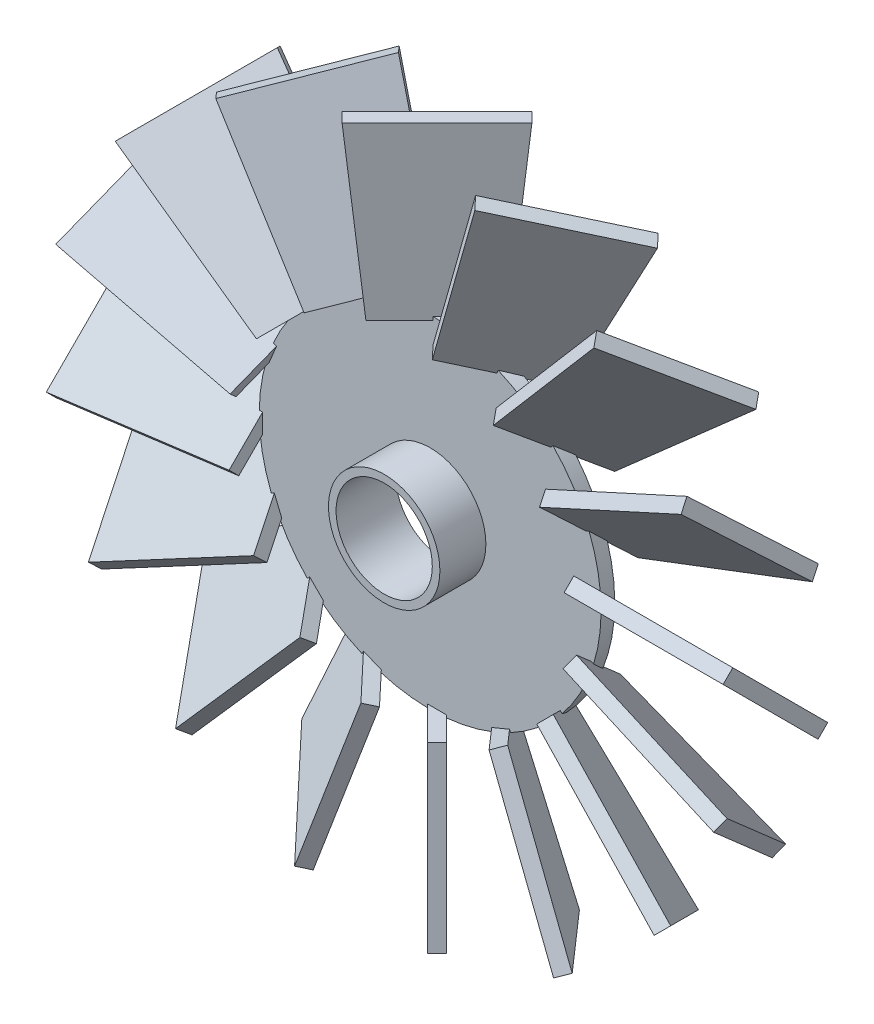
from build123d import *

# Parameters (mm, degrees)
SKETCH1_R           = 12.7
SKETCH1_R_2         = 3.57505
DISK_DEPTH          = 1.016
RECTANGLEFIN_START  = -12.446
RECTANGLEFIN_DEPTH  = 12.7
CUT_EXTRUDE3_DEPTH  = 25.4
SKETCH8_R           = 4.1402
SKETCH8_R_2         = 3.57505
BOSS_EXTRUDE4_DEPTH = 3.4163


with BuildPart() as part:
    # Sketch1 → Disk (new body)
    with BuildSketch(Plane.XY):
        Circle(SKETCH1_R)
        Circle(SKETCH1_R_2, mode=Mode.SUBTRACT)
    extrude(amount=DISK_DEPTH)


with BuildPart() as body_2:
    # Sketch5 → RectangleFin (new body)
    with BuildSketch(Plane(origin=(0, 0, 0), x_dir=(0, 0, -1), z_dir=(1, 0, 0)).offset(RECTANGLEFIN_START)):
        Polygon((-3.675336334, -3.885756824), (3.377756824, 3.167336334), (2.659336334, 3.885756824), (-4.393756824, -3.167336334), align=None)
    extrude(amount=-RECTANGLEFIN_DEPTH)


with BuildPart() as part_1:
    add(part.part)

    # Intersect1: read off the stored shape, not the designer's step
    # Intersect1: union body 2
    add(body_2.part)

    # Sketch6 → Cut-Extrude3 (cut)
    with BuildSketch(Plane(origin=(0, 0.613210245, 0.613210245), x_dir=(1, 0, 0), z_dir=(0, 0.7071067811865489, 0.7071067811865462))):
        Polygon((-12.446, 4.628079755), (-25.146, 4.628079755), (-12.446, 3.377238933), align=None)
        Polygon((-12.446, -4.095659422), (-25.146, -5.346500245), (-12.446, -5.346500245), align=None)
    extrude(amount=-CUT_EXTRUDE3_DEPTH, mode=Mode.SUBTRACT)

    # CirPattern2: read off the stored shape, not the designer's step
    # CirPattern2: loft between two sections, ruled curve by curve
    cirpattern2_from = [
        Edge.make_line((-12.647144333, 1.990057948, 2.790858306), (-11.967935464, 3.629813211, 1.016)),
        Edge.make_line((-11.579129097, 4.568474816, 0), (-10.624992609, 6.871964064, -2.493278796)),
        Edge.make_line((-24.718889483, 6.032986393, 3.675336334), (-22.019787585, 12.549194802, -3.377756824)),
        Edge.make_line((-24.718889483, 6.032986393, 3.675336334), (-12.647144333, 1.990057948, 2.790858306)),
        Edge.make_line((-10.624992609, 6.871964064, -2.493278796), (-22.019787585, 12.549194802, -3.377756824)),
        Edge.make_line((-11.579129097, 4.568474816, 0), (-11.967935464, 3.629813211, 1.016)),
    ]
    cirpattern2_to = [
        Edge.make_line((-12.372216714, 2.653791935, 3.509278796), (-11.418080226, 4.957281183, 1.016)),
        Edge.make_line((-11.029273859, 5.895942788, 0), (-10.350064991, 7.53569805, -1.774858306)),
        Edge.make_line((-24.443961864, 6.696720379, 4.393756824), (-21.744859966, 13.212928788, -2.659336334)),
        Edge.make_line((-24.443961864, 6.696720379, 4.393756824), (-12.372216714, 2.653791935, 3.509278796)),
        Edge.make_line((-10.350064991, 7.53569805, -1.774858306), (-21.744859966, 13.212928788, -2.659336334)),
        Edge.make_line((-11.029273859, 5.895942788, 0), (-11.418080226, 4.957281183, 1.016)),
    ]
    cirpattern2 = Solid(Shell([*[Face.make_surface_from_curves(cirpattern2_from[k], cirpattern2_to[k]) for k in range(6)], Face(Wire(cirpattern2_from)), Face(Wire(cirpattern2_to))]))
    add(cirpattern2)

    # CirPattern2 2: loft between two sections, ruled curve by curve
    cirpattern2_2_from = [
        Edge.make_line((-10.922875587, 6.67842641, 2.790858306), (-9.667861243, 7.933440754, 1.016)),
        Edge.make_line((-8.949440754, 8.651861243, 0), (-7.18642641, 10.414875587, -2.493278796)),
        Edge.make_line((-20.52855212, 15.03326212, 3.675336334), (-15.54126212, 20.02055212, -3.377756824)),
        Edge.make_line((-20.52855212, 15.03326212, 3.675336334), (-10.922875587, 6.67842641, 2.790858306)),
        Edge.make_line((-7.18642641, 10.414875587, -2.493278796), (-15.54126212, 20.02055212, -3.377756824)),
        Edge.make_line((-8.949440754, 8.651861243, 0), (-9.667861243, 7.933440754, 1.016)),
    ]
    cirpattern2_2_to = [
        Edge.make_line((-10.414875587, 7.18642641, 3.509278796), (-8.651861243, 8.949440754, 1.016)),
        Edge.make_line((-7.933440754, 9.667861243, 0), (-6.67842641, 10.922875587, -1.774858306)),
        Edge.make_line((-20.02055212, 15.54126212, 4.393756824), (-15.03326212, 20.52855212, -2.659336334)),
        Edge.make_line((-20.02055212, 15.54126212, 4.393756824), (-10.414875587, 7.18642641, 3.509278796)),
        Edge.make_line((-6.67842641, 10.922875587, -1.774858306), (-15.03326212, 20.52855212, -2.659336334)),
        Edge.make_line((-7.933440754, 9.667861243, 0), (-8.651861243, 8.949440754, 1.016)),
    ]
    cirpattern2_2 = Solid(Shell([*[Face.make_surface_from_curves(cirpattern2_2_from[k], cirpattern2_2_to[k]) for k in range(6)], Face(Wire(cirpattern2_2_from)), Face(Wire(cirpattern2_2_to))]))
    add(cirpattern2_2)

    # CirPattern2 3: loft between two sections, ruled curve by curve
    cirpattern2_3_from = [
        Edge.make_line((-7.53569805, 10.350064991, 2.790858306), (-5.895942788, 11.029273859, 1.016)),
        Edge.make_line((-4.957281183, 11.418080226, 0), (-2.653791935, 12.372216714, -2.493278796)),
        Edge.make_line((-13.212928788, 21.744859966, 3.675336334), (-6.696720379, 24.443961864, -3.377756824)),
        Edge.make_line((-13.212928788, 21.744859966, 3.675336334), (-7.53569805, 10.350064991, 2.790858306)),
        Edge.make_line((-2.653791935, 12.372216714, -2.493278796), (-6.696720379, 24.443961864, -3.377756824)),
        Edge.make_line((-4.957281183, 11.418080226, 0), (-5.895942788, 11.029273859, 1.016)),
    ]
    cirpattern2_3_to = [
        Edge.make_line((-6.871964064, 10.624992609, 3.509278796), (-4.568474816, 11.579129097, 1.016)),
        Edge.make_line((-3.629813211, 11.967935464, 0), (-1.990057948, 12.647144333, -1.774858306)),
        Edge.make_line((-12.549194802, 22.019787585, 4.393756824), (-6.032986393, 24.718889483, -2.659336334)),
        Edge.make_line((-12.549194802, 22.019787585, 4.393756824), (-6.871964064, 10.624992609, 3.509278796)),
        Edge.make_line((-1.990057948, 12.647144333, -1.774858306), (-6.032986393, 24.718889483, -2.659336334)),
        Edge.make_line((-3.629813211, 11.967935464, 0), (-4.568474816, 11.579129097, 1.016)),
    ]
    cirpattern2_3 = Solid(Shell([*[Face.make_surface_from_curves(cirpattern2_3_from[k], cirpattern2_3_to[k]) for k in range(6)], Face(Wire(cirpattern2_3_from)), Face(Wire(cirpattern2_3_to))]))
    add(cirpattern2_3)

    # CirPattern2 4: loft between two sections, ruled curve by curve
    cirpattern2_4_from = [
        Edge.make_line((-3.001278796, 12.446, 2.790858306), (-1.22642049, 12.446, 1.016)),
        Edge.make_line((-0.21042049, 12.446, 0), (2.282858306, 12.446, -2.493278796)),
        Edge.make_line((-3.885756824, 25.146, 3.675336334), (3.167336334, 25.146, -3.377756824)),
        Edge.make_line((-3.885756824, 25.146, 3.675336334), (-3.001278796, 12.446, 2.790858306)),
        Edge.make_line((2.282858306, 12.446, -2.493278796), (3.167336334, 25.146, -3.377756824)),
        Edge.make_line((-0.21042049, 12.446, 0), (-1.22642049, 12.446, 1.016)),
    ]
    cirpattern2_4_to = [
        Edge.make_line((-2.282858306, 12.446, 3.509278796), (0.21042049, 12.446, 1.016)),
        Edge.make_line((1.22642049, 12.446, 0), (3.001278796, 12.446, -1.774858306)),
        Edge.make_line((-3.167336334, 25.146, 4.393756824), (3.885756824, 25.146, -2.659336334)),
        Edge.make_line((-3.167336334, 25.146, 4.393756824), (-2.282858306, 12.446, 3.509278796)),
        Edge.make_line((3.001278796, 12.446, -1.774858306), (3.885756824, 25.146, -2.659336334)),
        Edge.make_line((1.22642049, 12.446, 0), (0.21042049, 12.446, 1.016)),
    ]
    cirpattern2_4 = Solid(Shell([*[Face.make_surface_from_curves(cirpattern2_4_from[k], cirpattern2_4_to[k]) for k in range(6)], Face(Wire(cirpattern2_4_from)), Face(Wire(cirpattern2_4_to))]))
    add(cirpattern2_4)

    # CirPattern2 5: loft between two sections, ruled curve by curve
    cirpattern2_5_from = [
        Edge.make_line((1.990057948, 12.647144333, 2.790858306), (3.629813211, 11.967935464, 1.016)),
        Edge.make_line((4.568474816, 11.579129097, 0), (6.871964064, 10.624992609, -2.493278796)),
        Edge.make_line((6.032986393, 24.718889483, 3.675336334), (12.549194802, 22.019787585, -3.377756824)),
        Edge.make_line((6.032986393, 24.718889483, 3.675336334), (1.990057948, 12.647144333, 2.790858306)),
        Edge.make_line((6.871964064, 10.624992609, -2.493278796), (12.549194802, 22.019787585, -3.377756824)),
        Edge.make_line((4.568474816, 11.579129097, 0), (3.629813211, 11.967935464, 1.016)),
    ]
    cirpattern2_5_to = [
        Edge.make_line((2.653791935, 12.372216714, 3.509278796), (4.957281183, 11.418080226, 1.016)),
        Edge.make_line((5.895942788, 11.029273859, 0), (7.53569805, 10.350064991, -1.774858306)),
        Edge.make_line((6.696720379, 24.443961864, 4.393756824), (13.212928788, 21.744859966, -2.659336334)),
        Edge.make_line((6.696720379, 24.443961864, 4.393756824), (2.653791935, 12.372216714, 3.509278796)),
        Edge.make_line((7.53569805, 10.350064991, -1.774858306), (13.212928788, 21.744859966, -2.659336334)),
        Edge.make_line((5.895942788, 11.029273859, 0), (4.957281183, 11.418080226, 1.016)),
    ]
    cirpattern2_5 = Solid(Shell([*[Face.make_surface_from_curves(cirpattern2_5_from[k], cirpattern2_5_to[k]) for k in range(6)], Face(Wire(cirpattern2_5_from)), Face(Wire(cirpattern2_5_to))]))
    add(cirpattern2_5)

    # CirPattern2 6: loft between two sections, ruled curve by curve
    cirpattern2_6_from = [
        Edge.make_line((6.67842641, 10.922875587, 2.790858306), (7.933440754, 9.667861243, 1.016)),
        Edge.make_line((8.651861243, 8.949440754, 0), (10.414875587, 7.18642641, -2.493278796)),
        Edge.make_line((15.03326212, 20.52855212, 3.675336334), (20.02055212, 15.54126212, -3.377756824)),
        Edge.make_line((15.03326212, 20.52855212, 3.675336334), (6.67842641, 10.922875587, 2.790858306)),
        Edge.make_line((10.414875587, 7.18642641, -2.493278796), (20.02055212, 15.54126212, -3.377756824)),
        Edge.make_line((8.651861243, 8.949440754, 0), (7.933440754, 9.667861243, 1.016)),
    ]
    cirpattern2_6_to = [
        Edge.make_line((7.18642641, 10.414875587, 3.509278796), (8.949440754, 8.651861243, 1.016)),
        Edge.make_line((9.667861243, 7.933440754, 0), (10.922875587, 6.67842641, -1.774858306)),
        Edge.make_line((15.54126212, 20.02055212, 4.393756824), (20.52855212, 15.03326212, -2.659336334)),
        Edge.make_line((15.54126212, 20.02055212, 4.393756824), (7.18642641, 10.414875587, 3.509278796)),
        Edge.make_line((10.922875587, 6.67842641, -1.774858306), (20.52855212, 15.03326212, -2.659336334)),
        Edge.make_line((9.667861243, 7.933440754, 0), (8.949440754, 8.651861243, 1.016)),
    ]
    cirpattern2_6 = Solid(Shell([*[Face.make_surface_from_curves(cirpattern2_6_from[k], cirpattern2_6_to[k]) for k in range(6)], Face(Wire(cirpattern2_6_from)), Face(Wire(cirpattern2_6_to))]))
    add(cirpattern2_6)

    # CirPattern2 7: loft between two sections, ruled curve by curve
    cirpattern2_7_from = [
        Edge.make_line((10.350064991, 7.53569805, 2.790858306), (11.029273859, 5.895942788, 1.016)),
        Edge.make_line((11.418080226, 4.957281183, 0), (12.372216714, 2.653791935, -2.493278796)),
        Edge.make_line((21.744859966, 13.212928788, 3.675336334), (24.443961864, 6.696720379, -3.377756824)),
        Edge.make_line((21.744859966, 13.212928788, 3.675336334), (10.350064991, 7.53569805, 2.790858306)),
        Edge.make_line((12.372216714, 2.653791935, -2.493278796), (24.443961864, 6.696720379, -3.377756824)),
        Edge.make_line((11.418080226, 4.957281183, 0), (11.029273859, 5.895942788, 1.016)),
    ]
    cirpattern2_7_to = [
        Edge.make_line((10.624992609, 6.871964064, 3.509278796), (11.579129097, 4.568474816, 1.016)),
        Edge.make_line((11.967935464, 3.629813211, 0), (12.647144333, 1.990057948, -1.774858306)),
        Edge.make_line((22.019787585, 12.549194802, 4.393756824), (24.718889483, 6.032986393, -2.659336334)),
        Edge.make_line((22.019787585, 12.549194802, 4.393756824), (10.624992609, 6.871964064, 3.509278796)),
        Edge.make_line((12.647144333, 1.990057948, -1.774858306), (24.718889483, 6.032986393, -2.659336334)),
        Edge.make_line((11.967935464, 3.629813211, 0), (11.579129097, 4.568474816, 1.016)),
    ]
    cirpattern2_7 = Solid(Shell([*[Face.make_surface_from_curves(cirpattern2_7_from[k], cirpattern2_7_to[k]) for k in range(6)], Face(Wire(cirpattern2_7_from)), Face(Wire(cirpattern2_7_to))]))
    add(cirpattern2_7)

    # CirPattern2 8: loft between two sections, ruled curve by curve
    cirpattern2_8_from = [
        Edge.make_line((12.446, 3.001278796, 2.790858306), (12.446, 1.22642049, 1.016)),
        Edge.make_line((12.446, 0.21042049, 0), (12.446, -2.282858306, -2.493278796)),
        Edge.make_line((25.146, 3.885756824, 3.675336334), (25.146, -3.167336334, -3.377756824)),
        Edge.make_line((25.146, 3.885756824, 3.675336334), (12.446, 3.001278796, 2.790858306)),
        Edge.make_line((12.446, -2.282858306, -2.493278796), (25.146, -3.167336334, -3.377756824)),
        Edge.make_line((12.446, 0.21042049, 0), (12.446, 1.22642049, 1.016)),
    ]
    cirpattern2_8_to = [
        Edge.make_line((12.446, 2.282858306, 3.509278796), (12.446, -0.21042049, 1.016)),
        Edge.make_line((12.446, -1.22642049, 0), (12.446, -3.001278796, -1.774858306)),
        Edge.make_line((25.146, 3.167336334, 4.393756824), (25.146, -3.885756824, -2.659336334)),
        Edge.make_line((25.146, 3.167336334, 4.393756824), (12.446, 2.282858306, 3.509278796)),
        Edge.make_line((12.446, -3.001278796, -1.774858306), (25.146, -3.885756824, -2.659336334)),
        Edge.make_line((12.446, -1.22642049, 0), (12.446, -0.21042049, 1.016)),
    ]
    cirpattern2_8 = Solid(Shell([*[Face.make_surface_from_curves(cirpattern2_8_from[k], cirpattern2_8_to[k]) for k in range(6)], Face(Wire(cirpattern2_8_from)), Face(Wire(cirpattern2_8_to))]))
    add(cirpattern2_8)

    # CirPattern2 9: loft between two sections, ruled curve by curve
    cirpattern2_9_from = [
        Edge.make_line((12.647144333, -1.990057948, 2.790858306), (11.967935464, -3.629813211, 1.016)),
        Edge.make_line((11.579129097, -4.568474816, 0), (10.624992609, -6.871964064, -2.493278796)),
        Edge.make_line((24.718889483, -6.032986393, 3.675336334), (22.019787585, -12.549194802, -3.377756824)),
        Edge.make_line((24.718889483, -6.032986393, 3.675336334), (12.647144333, -1.990057948, 2.790858306)),
        Edge.make_line((10.624992609, -6.871964064, -2.493278796), (22.019787585, -12.549194802, -3.377756824)),
        Edge.make_line((11.579129097, -4.568474816, 0), (11.967935464, -3.629813211, 1.016)),
    ]
    cirpattern2_9_to = [
        Edge.make_line((12.372216714, -2.653791935, 3.509278796), (11.418080226, -4.957281183, 1.016)),
        Edge.make_line((11.029273859, -5.895942788, 0), (10.350064991, -7.53569805, -1.774858306)),
        Edge.make_line((24.443961864, -6.696720379, 4.393756824), (21.744859966, -13.212928788, -2.659336334)),
        Edge.make_line((24.443961864, -6.696720379, 4.393756824), (12.372216714, -2.653791935, 3.509278796)),
        Edge.make_line((10.350064991, -7.53569805, -1.774858306), (21.744859966, -13.212928788, -2.659336334)),
        Edge.make_line((11.029273859, -5.895942788, 0), (11.418080226, -4.957281183, 1.016)),
    ]
    cirpattern2_9 = Solid(Shell([*[Face.make_surface_from_curves(cirpattern2_9_from[k], cirpattern2_9_to[k]) for k in range(6)], Face(Wire(cirpattern2_9_from)), Face(Wire(cirpattern2_9_to))]))
    add(cirpattern2_9)

    # CirPattern2 10: loft between two sections, ruled curve by curve
    cirpattern2_10_from = [
        Edge.make_line((10.922875587, -6.67842641, 2.790858306), (9.667861243, -7.933440754, 1.016)),
        Edge.make_line((8.949440754, -8.651861243, 0), (7.18642641, -10.414875587, -2.493278796)),
        Edge.make_line((20.52855212, -15.03326212, 3.675336334), (15.54126212, -20.02055212, -3.377756824)),
        Edge.make_line((20.52855212, -15.03326212, 3.675336334), (10.922875587, -6.67842641, 2.790858306)),
        Edge.make_line((7.18642641, -10.414875587, -2.493278796), (15.54126212, -20.02055212, -3.377756824)),
        Edge.make_line((8.949440754, -8.651861243, 0), (9.667861243, -7.933440754, 1.016)),
    ]
    cirpattern2_10_to = [
        Edge.make_line((10.414875587, -7.18642641, 3.509278796), (8.651861243, -8.949440754, 1.016)),
        Edge.make_line((7.933440754, -9.667861243, 0), (6.67842641, -10.922875587, -1.774858306)),
        Edge.make_line((20.02055212, -15.54126212, 4.393756824), (15.03326212, -20.52855212, -2.659336334)),
        Edge.make_line((20.02055212, -15.54126212, 4.393756824), (10.414875587, -7.18642641, 3.509278796)),
        Edge.make_line((6.67842641, -10.922875587, -1.774858306), (15.03326212, -20.52855212, -2.659336334)),
        Edge.make_line((7.933440754, -9.667861243, 0), (8.651861243, -8.949440754, 1.016)),
    ]
    cirpattern2_10 = Solid(Shell([*[Face.make_surface_from_curves(cirpattern2_10_from[k], cirpattern2_10_to[k]) for k in range(6)], Face(Wire(cirpattern2_10_from)), Face(Wire(cirpattern2_10_to))]))
    add(cirpattern2_10)

    # CirPattern2 11: loft between two sections, ruled curve by curve
    cirpattern2_11_from = [
        Edge.make_line((7.53569805, -10.350064991, 2.790858306), (5.895942788, -11.029273859, 1.016)),
        Edge.make_line((4.957281183, -11.418080226, 0), (2.653791935, -12.372216714, -2.493278796)),
        Edge.make_line((13.212928788, -21.744859966, 3.675336334), (6.696720379, -24.443961864, -3.377756824)),
        Edge.make_line((13.212928788, -21.744859966, 3.675336334), (7.53569805, -10.350064991, 2.790858306)),
        Edge.make_line((2.653791935, -12.372216714, -2.493278796), (6.696720379, -24.443961864, -3.377756824)),
        Edge.make_line((4.957281183, -11.418080226, 0), (5.895942788, -11.029273859, 1.016)),
    ]
    cirpattern2_11_to = [
        Edge.make_line((6.871964064, -10.624992609, 3.509278796), (4.568474816, -11.579129097, 1.016)),
        Edge.make_line((3.629813211, -11.967935464, 0), (1.990057948, -12.647144333, -1.774858306)),
        Edge.make_line((12.549194802, -22.019787585, 4.393756824), (6.032986393, -24.718889483, -2.659336334)),
        Edge.make_line((12.549194802, -22.019787585, 4.393756824), (6.871964064, -10.624992609, 3.509278796)),
        Edge.make_line((1.990057948, -12.647144333, -1.774858306), (6.032986393, -24.718889483, -2.659336334)),
        Edge.make_line((3.629813211, -11.967935464, 0), (4.568474816, -11.579129097, 1.016)),
    ]
    cirpattern2_11 = Solid(Shell([*[Face.make_surface_from_curves(cirpattern2_11_from[k], cirpattern2_11_to[k]) for k in range(6)], Face(Wire(cirpattern2_11_from)), Face(Wire(cirpattern2_11_to))]))
    add(cirpattern2_11)

    # CirPattern2 12: loft between two sections, ruled curve by curve
    cirpattern2_12_from = [
        Edge.make_line((3.001278796, -12.446, 2.790858306), (1.22642049, -12.446, 1.016)),
        Edge.make_line((0.21042049, -12.446, 0), (-2.282858306, -12.446, -2.493278796)),
        Edge.make_line((3.885756824, -25.146, 3.675336334), (-3.167336334, -25.146, -3.377756824)),
        Edge.make_line((3.885756824, -25.146, 3.675336334), (3.001278796, -12.446, 2.790858306)),
        Edge.make_line((-2.282858306, -12.446, -2.493278796), (-3.167336334, -25.146, -3.377756824)),
        Edge.make_line((0.21042049, -12.446, 0), (1.22642049, -12.446, 1.016)),
    ]
    cirpattern2_12_to = [
        Edge.make_line((2.282858306, -12.446, 3.509278796), (-0.21042049, -12.446, 1.016)),
        Edge.make_line((-1.22642049, -12.446, 0), (-3.001278796, -12.446, -1.774858306)),
        Edge.make_line((3.167336334, -25.146, 4.393756824), (-3.885756824, -25.146, -2.659336334)),
        Edge.make_line((3.167336334, -25.146, 4.393756824), (2.282858306, -12.446, 3.509278796)),
        Edge.make_line((-3.001278796, -12.446, -1.774858306), (-3.885756824, -25.146, -2.659336334)),
        Edge.make_line((-1.22642049, -12.446, 0), (-0.21042049, -12.446, 1.016)),
    ]
    cirpattern2_12 = Solid(Shell([*[Face.make_surface_from_curves(cirpattern2_12_from[k], cirpattern2_12_to[k]) for k in range(6)], Face(Wire(cirpattern2_12_from)), Face(Wire(cirpattern2_12_to))]))
    add(cirpattern2_12)

    # CirPattern2 13: loft between two sections, ruled curve by curve
    cirpattern2_13_from = [
        Edge.make_line((-1.990057948, -12.647144333, 2.790858306), (-3.629813211, -11.967935464, 1.016)),
        Edge.make_line((-4.568474816, -11.579129097, 0), (-6.871964064, -10.624992609, -2.493278796)),
        Edge.make_line((-6.032986393, -24.718889483, 3.675336334), (-12.549194802, -22.019787585, -3.377756824)),
        Edge.make_line((-6.032986393, -24.718889483, 3.675336334), (-1.990057948, -12.647144333, 2.790858306)),
        Edge.make_line((-6.871964064, -10.624992609, -2.493278796), (-12.549194802, -22.019787585, -3.377756824)),
        Edge.make_line((-4.568474816, -11.579129097, 0), (-3.629813211, -11.967935464, 1.016)),
    ]
    cirpattern2_13_to = [
        Edge.make_line((-2.653791935, -12.372216714, 3.509278796), (-4.957281183, -11.418080226, 1.016)),
        Edge.make_line((-5.895942788, -11.029273859, 0), (-7.53569805, -10.350064991, -1.774858306)),
        Edge.make_line((-6.696720379, -24.443961864, 4.393756824), (-13.212928788, -21.744859966, -2.659336334)),
        Edge.make_line((-6.696720379, -24.443961864, 4.393756824), (-2.653791935, -12.372216714, 3.509278796)),
        Edge.make_line((-7.53569805, -10.350064991, -1.774858306), (-13.212928788, -21.744859966, -2.659336334)),
        Edge.make_line((-5.895942788, -11.029273859, 0), (-4.957281183, -11.418080226, 1.016)),
    ]
    cirpattern2_13 = Solid(Shell([*[Face.make_surface_from_curves(cirpattern2_13_from[k], cirpattern2_13_to[k]) for k in range(6)], Face(Wire(cirpattern2_13_from)), Face(Wire(cirpattern2_13_to))]))
    add(cirpattern2_13)

    # CirPattern2 14: loft between two sections, ruled curve by curve
    cirpattern2_14_from = [
        Edge.make_line((-6.67842641, -10.922875587, 2.790858306), (-7.933440754, -9.667861243, 1.016)),
        Edge.make_line((-8.651861243, -8.949440754, 0), (-10.414875587, -7.18642641, -2.493278796)),
        Edge.make_line((-15.03326212, -20.52855212, 3.675336334), (-20.02055212, -15.54126212, -3.377756824)),
        Edge.make_line((-15.03326212, -20.52855212, 3.675336334), (-6.67842641, -10.922875587, 2.790858306)),
        Edge.make_line((-10.414875587, -7.18642641, -2.493278796), (-20.02055212, -15.54126212, -3.377756824)),
        Edge.make_line((-8.651861243, -8.949440754, 0), (-7.933440754, -9.667861243, 1.016)),
    ]
    cirpattern2_14_to = [
        Edge.make_line((-7.18642641, -10.414875587, 3.509278796), (-8.949440754, -8.651861243, 1.016)),
        Edge.make_line((-9.667861243, -7.933440754, 0), (-10.922875587, -6.67842641, -1.774858306)),
        Edge.make_line((-15.54126212, -20.02055212, 4.393756824), (-20.52855212, -15.03326212, -2.659336334)),
        Edge.make_line((-15.54126212, -20.02055212, 4.393756824), (-7.18642641, -10.414875587, 3.509278796)),
        Edge.make_line((-10.922875587, -6.67842641, -1.774858306), (-20.52855212, -15.03326212, -2.659336334)),
        Edge.make_line((-9.667861243, -7.933440754, 0), (-8.949440754, -8.651861243, 1.016)),
    ]
    cirpattern2_14 = Solid(Shell([*[Face.make_surface_from_curves(cirpattern2_14_from[k], cirpattern2_14_to[k]) for k in range(6)], Face(Wire(cirpattern2_14_from)), Face(Wire(cirpattern2_14_to))]))
    add(cirpattern2_14)

    # CirPattern2 15: loft between two sections, ruled curve by curve
    cirpattern2_15_from = [
        Edge.make_line((-10.350064991, -7.53569805, 2.790858306), (-11.029273859, -5.895942788, 1.016)),
        Edge.make_line((-11.418080226, -4.957281183, 0), (-12.372216714, -2.653791935, -2.493278796)),
        Edge.make_line((-21.744859966, -13.212928788, 3.675336334), (-24.443961864, -6.696720379, -3.377756824)),
        Edge.make_line((-21.744859966, -13.212928788, 3.675336334), (-10.350064991, -7.53569805, 2.790858306)),
        Edge.make_line((-12.372216714, -2.653791935, -2.493278796), (-24.443961864, -6.696720379, -3.377756824)),
        Edge.make_line((-11.418080226, -4.957281183, 0), (-11.029273859, -5.895942788, 1.016)),
    ]
    cirpattern2_15_to = [
        Edge.make_line((-10.624992609, -6.871964064, 3.509278796), (-11.579129097, -4.568474816, 1.016)),
        Edge.make_line((-11.967935464, -3.629813211, 0), (-12.647144333, -1.990057948, -1.774858306)),
        Edge.make_line((-22.019787585, -12.549194802, 4.393756824), (-24.718889483, -6.032986393, -2.659336334)),
        Edge.make_line((-22.019787585, -12.549194802, 4.393756824), (-10.624992609, -6.871964064, 3.509278796)),
        Edge.make_line((-12.647144333, -1.990057948, -1.774858306), (-24.718889483, -6.032986393, -2.659336334)),
        Edge.make_line((-11.967935464, -3.629813211, 0), (-11.579129097, -4.568474816, 1.016)),
    ]
    cirpattern2_15 = Solid(Shell([*[Face.make_surface_from_curves(cirpattern2_15_from[k], cirpattern2_15_to[k]) for k in range(6)], Face(Wire(cirpattern2_15_from)), Face(Wire(cirpattern2_15_to))]))
    add(cirpattern2_15)

    # Sketch8 → Boss-Extrude4 (add)
    with BuildSketch(Plane.XY.offset(1.016)):
        Circle(SKETCH8_R)
        Circle(SKETCH8_R_2, mode=Mode.SUBTRACT)
    extrude(amount=BOSS_EXTRUDE4_DEPTH)


solid = part_1.part
